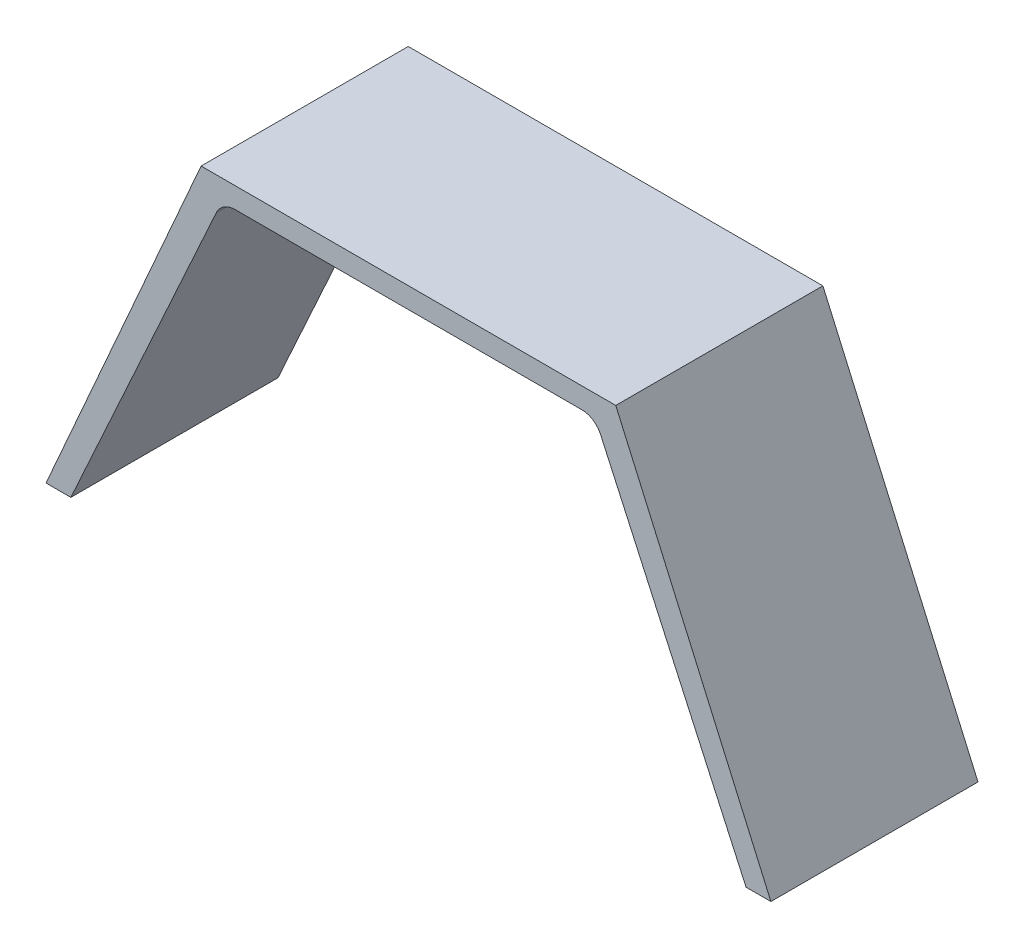
from build123d import *

# Parameters (mm, degrees)
BOSS_EXTRUDE2_DEPTH = 50
CUT_EXTRUDE1_DEPTH  = 50
FILLET1_R           = 5


with BuildPart() as part:
    # Sketch1 → Boss-Extrude2 (new body)
    with BuildSketch(Plane.XY):
        Polygon((-87.5, 0), (87.5, 0), (50.05, 85), (-50.05, 85), align=None)
    extrude(amount=BOSS_EXTRUDE2_DEPTH)

    # Sketch3 → Cut-Extrude1 (cut)
    with BuildSketch(Plane.XY.offset(50)):
        Polygon((-81.5, 0), (81.5, 0), (45.05, 80), (-45.05, 80), align=None)
    extrude(amount=-CUT_EXTRUDE1_DEPTH, mode=Mode.SUBTRACT)

    # Fillet1
    fillet1_edges = [part.edges().sort_by_distance(p)[0] for p in [
        (45.05, 80, 25),
        (-45.05, 80, 25),
    ]]
    fillet(fillet1_edges, radius=FILLET1_R)


solid = part.part
